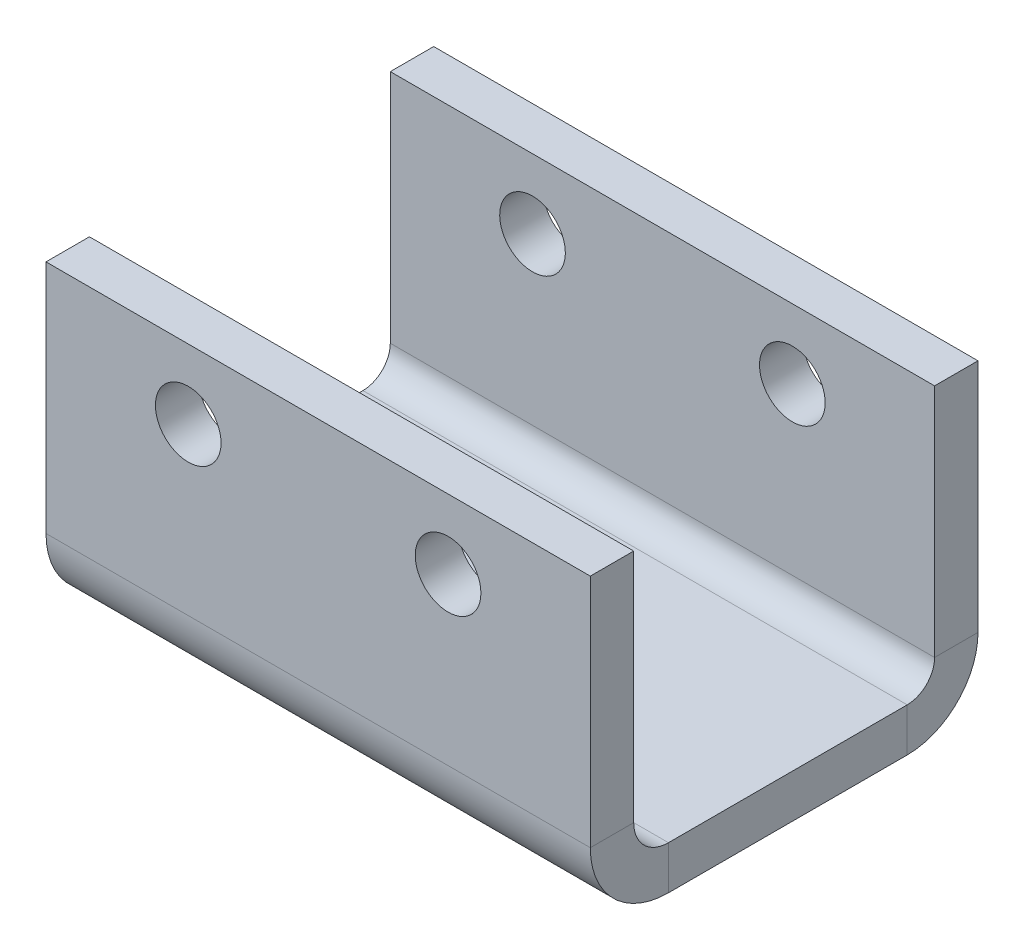
from build123d import *

# Parameters (mm, degrees)
SKETCH1_W                = 19.9
SKETCH1_H                = 8.6
SKETCH1_R                = 1.2
BOSS_EXTRUDE1_DEPTH      = 0.79375
CONVERT_SOLID2_START     = -0.79375
CONVERT_SOLID2_OUTLINE_W = 19.9
CONVERT_SOLID2_OUTLINE_H = 8.6
CONVERT_SOLID2_OUTLINE_R = 1.2
CONVERT_SOLID2_DEPTH     = 0.79375
EDGE_FLANGE1_DEPTH       = 19.9
EDGE_FLANGE2_DEPTH       = 19.9
EDGE_FLANGE2_START       = 1.5875
EDGE_FLANGE2_PROFILE_W   = 19.9
EDGE_FLANGE2_PROFILE_H   = 8.6
EDGE_FLANGE2_PROFILE_R   = 1.2
EDGE_FLANGE2_FLAT_DEPTH  = 1.5875


# Read off the part's stored shape, not the designer's step: Convert-Solid2
# Sheet-metal steps are written as plain solids
with BuildPart() as part:
    # Sketch1 → Boss-Extrude1 (new body)
    with BuildSketch(Plane.XY):
        with Locations((0, -1.76)):
            Rectangle(SKETCH1_W, SKETCH1_H)
        with Locations((-4.75, 0)):
            Circle(SKETCH1_R, mode=Mode.SUBTRACT)
        with Locations((4.75, 0)):
            Circle(SKETCH1_R, mode=Mode.SUBTRACT)
    extrude(amount=BOSS_EXTRUDE1_DEPTH)

    # Convert-Solid2 outline → Convert-Solid2 (add)
    with BuildSketch(Plane.XY.offset(CONVERT_SOLID2_START)):
        with Locations((0, -1.76)):
            Rectangle(CONVERT_SOLID2_OUTLINE_W, CONVERT_SOLID2_OUTLINE_H)
        with Locations((-4.75, 0)):
            Circle(CONVERT_SOLID2_OUTLINE_R, mode=Mode.SUBTRACT)
        with Locations((4.75, 0)):
            Circle(CONVERT_SOLID2_OUTLINE_R, mode=Mode.SUBTRACT)
    extrude(amount=CONVERT_SOLID2_DEPTH)

    # Edge-Flange1 section (across the edge) → Edge-Flange1 (add)
    with BuildSketch(Plane(origin=(9.95, -7.33, -0.79375), x_dir=(0, 1, 0), z_dir=(-1, 0, 0))):
        with BuildLine():
            Line((-1.5875, 1.27), (-1.5875, 10))
            Line((-1.5875, 10), (0, 10))
            Line((0, 10), (0, 1.27))
            ThreePointArc((0, 1.27), (0.371974388, 0.371974388), (1.27, 0))
            Line((1.27, 0), (1.27, -1.5875))
            ThreePointArc((1.27, -1.5875), (-0.750557627, -0.750557627), (-1.5875, 1.27))
        make_face()
    extrude(amount=EDGE_FLANGE1_DEPTH)

    # Edge-Flange2 bend section (across the edge) → Edge-Flange2 (add)
    with BuildSketch(Plane(origin=(9.95, -7.33, -11.79375), x_dir=(0, 0, 1), z_dir=(-1, 0, 0))):
        with BuildLine():
            Line((-1.5875, 1), (0, 1))
            ThreePointArc((0, 1), (0.292893219, 0.292893219), (1, 0))
            Line((1, 0), (1, -1.5875))
            ThreePointArc((1, -1.5875), (-0.829638796, -0.829638796), (-1.5875, 1))
        make_face()
    extrude(amount=EDGE_FLANGE2_DEPTH)

    # Edge-Flange2 profile (on flange) → Edge-Flange2 flat (add)
    with BuildSketch(Plane(origin=(0, -7.33, -11.79375), x_dir=(-1, 0, 0), z_dir=(0, 0, -1)).offset(EDGE_FLANGE2_START)):
        with Locations((0, 5.3)):
            Rectangle(EDGE_FLANGE2_PROFILE_W, EDGE_FLANGE2_PROFILE_H)
        with Locations((-4.75, 7.06)):
            Circle(EDGE_FLANGE2_PROFILE_R, mode=Mode.SUBTRACT)
        with Locations((4.75, 7.06)):
            Circle(EDGE_FLANGE2_PROFILE_R, mode=Mode.SUBTRACT)
    extrude(amount=-EDGE_FLANGE2_FLAT_DEPTH)


solid = part.part
